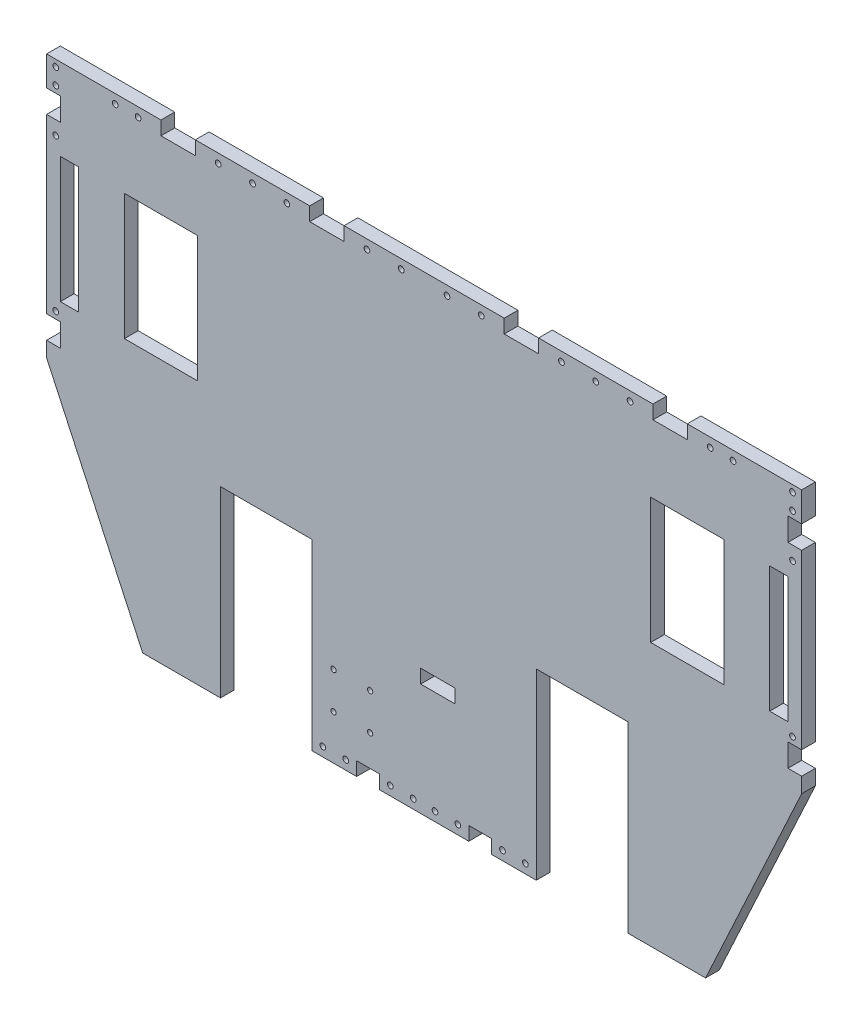
from build123d import *

# Parameters (mm, degrees)
ESQUISSE1_R             = 1.15
ESQUISSE1_W             = 15
ESQUISSE1_H             = 6
BOSS_EXTRU_1_DEPTH      = 6
ESQUISSE2_W             = 8
ESQUISSE2_H             = 55
ESQUISSE2_W_2           = 32
ESQUISSE2_W_3           = 40
ESQUISSE2_H_2           = 80
ENL_V_MAT_EXTRU_1_DEPTH = 6
ESQUISSE3_W             = 6
ESQUISSE3_H             = 10
ESQUISSE3_W_2           = 10
ESQUISSE3_H_2           = 6
ESQUISSE3_W_3           = 15
ENL_V_MAT_EXTRU_2_DEPTH = 6
ESQUISSE4_R             = 1.25
ENL_V_MAT_EXTRU_3_DEPTH = 6


with BuildPart() as part:
    # Esquisse1 → Boss.-Extru.1 (new body)
    with BuildSketch(Plane.XY):
        Polygon((-165, 96.73), (165, 96.73), (165, -18.27), (123, -109.022410436), (-123, -109.022410436), (-165, -18.27), align=None)
        with Locations((-23.6, -89.522410436)):
            Circle(ESQUISSE1_R, mode=Mode.SUBTRACT)
        with Locations((-23.6, -73.522410436)):
            Circle(ESQUISSE1_R, mode=Mode.SUBTRACT)
        with Locations((-39.6, -89.522410436)):
            Circle(ESQUISSE1_R, mode=Mode.SUBTRACT)
        with Locations((-39.6, -73.522410436)):
            Circle(ESQUISSE1_R, mode=Mode.SUBTRACT)
        with Locations((6, -57.022410436)):
            Rectangle(ESQUISSE1_W, ESQUISSE1_H, mode=Mode.SUBTRACT)
    extrude(amount=BOSS_EXTRU_1_DEPTH)

    # Esquisse2 → Enlèv. mat.-Extru.1 (cut)
    with BuildSketch(Plane.XY.offset(6)):
        with Locations((-155, 33.477589564)):
            Rectangle(ESQUISSE2_W, ESQUISSE2_H)
        with Locations((-115, 33.477589564)):
            Rectangle(ESQUISSE2_W_2, ESQUISSE2_H)
        with Locations((115, 33.477589564)):
            Rectangle(ESQUISSE2_W_2, ESQUISSE2_H)
        with Locations((155, 33.477589564)):
            Rectangle(ESQUISSE2_W, ESQUISSE2_H)
        with Locations((69, -69.022410436)):
            Rectangle(ESQUISSE2_W_3, ESQUISSE2_H_2)
        with Locations((-69, -69.022410436)):
            Rectangle(ESQUISSE2_W_3, ESQUISSE2_H_2)
    extrude(amount=-ENL_V_MAT_EXTRU_1_DEPTH, mode=Mode.SUBTRACT)

    # Esquisse3 → Enlèv. mat.-Extru.2 (cut)
    with BuildSketch(Plane(origin=(0, 0, 0), x_dir=(-1, 0, 0), z_dir=(0, 0, -1))):
        with Locations((162, -6.645)):
            Rectangle(ESQUISSE3_W, ESQUISSE3_H)
        with Locations((162, 78.852589564)):
            Rectangle(ESQUISSE3_W, ESQUISSE3_H)
        with Locations((24.5, -106.022410436)):
            Rectangle(ESQUISSE3_W_2, ESQUISSE3_H_2)
        with Locations((-24.5, -106.022410436)):
            Rectangle(ESQUISSE3_W_2, ESQUISSE3_H_2)
        with Locations((-162, 78.852589564)):
            Rectangle(ESQUISSE3_W, ESQUISSE3_H)
        with Locations((-162, -6.645)):
            Rectangle(ESQUISSE3_W, ESQUISSE3_H)
        with Locations((107.5, 93.73)):
            Rectangle(ESQUISSE3_W_3, ESQUISSE3_H_2)
        with Locations((-42.5, 93.73)):
            Rectangle(ESQUISSE3_W_3, ESQUISSE3_H_2)
        with Locations((42.5, 93.73)):
            Rectangle(ESQUISSE3_W_3, ESQUISSE3_H_2)
        with Locations((-107.5, 93.73)):
            Rectangle(ESQUISSE3_W_3, ESQUISSE3_H_2)
    extrude(amount=-ENL_V_MAT_EXTRU_2_DEPTH, mode=Mode.SUBTRACT)

    # Esquisse4 → Enlèv. mat.-Extru.3 (cut)
    with BuildSketch(Plane(origin=(0, 0, 0), x_dir=(-1, 0, 0), z_dir=(0, 0, -1))):
        with Locations((161, 1.355)):
            Circle(ESQUISSE4_R)
        with Locations((161, 67.852589564)):
            Circle(ESQUISSE4_R)
        with Locations((161, 86.852589564)):
            Circle(ESQUISSE4_R)
        with Locations((161, 93.852589564)):
            Circle(ESQUISSE4_R)
        with Locations((44.25, -105.022410436)):
            Circle(ESQUISSE4_R)
        with Locations((14.75, -105.022410436)):
            Circle(ESQUISSE4_R)
        with Locations((4.75, -105.022410436)):
            Circle(ESQUISSE4_R)
        with Locations((34.249651607, -105.022410436)):
            Circle(ESQUISSE4_R)
        with Locations((135, 92.73)):
            Circle(ESQUISSE4_R)
        with Locations((125, 92.73)):
            Circle(ESQUISSE4_R)
        with Locations((90, 92.73)):
            Circle(ESQUISSE4_R)
        with Locations((75, 92.73)):
            Circle(ESQUISSE4_R)
        with Locations((60, 92.73)):
            Circle(ESQUISSE4_R)
        with Locations((25, 92.73)):
            Circle(ESQUISSE4_R)
        with Locations((10, 92.73)):
            Circle(ESQUISSE4_R)
        with Locations((-10, 92.73)):
            Circle(ESQUISSE4_R)
        with Locations((-25, 92.73)):
            Circle(ESQUISSE4_R)
        with Locations((-60, 92.73)):
            Circle(ESQUISSE4_R)
        with Locations((-75, 92.73)):
            Circle(ESQUISSE4_R)
        with Locations((-90, 92.73)):
            Circle(ESQUISSE4_R)
        with Locations((-125, 92.73)):
            Circle(ESQUISSE4_R)
        with Locations((-135, 92.73)):
            Circle(ESQUISSE4_R)
        with Locations((-34.249651607, -105.022410436)):
            Circle(ESQUISSE4_R)
        with Locations((-4.75, -105.022410436)):
            Circle(ESQUISSE4_R)
        with Locations((-14.75, -105.022410436)):
            Circle(ESQUISSE4_R)
        with Locations((-44.25, -105.022410436)):
            Circle(ESQUISSE4_R)
        with Locations((-161, 93.852589564)):
            Circle(ESQUISSE4_R)
        with Locations((-161, 86.852589564)):
            Circle(ESQUISSE4_R)
        with Locations((-161, 67.852589564)):
            Circle(ESQUISSE4_R)
        with Locations((-161, 1.355)):
            Circle(ESQUISSE4_R)
    extrude(amount=-ENL_V_MAT_EXTRU_3_DEPTH, mode=Mode.SUBTRACT)


solid = part.part
